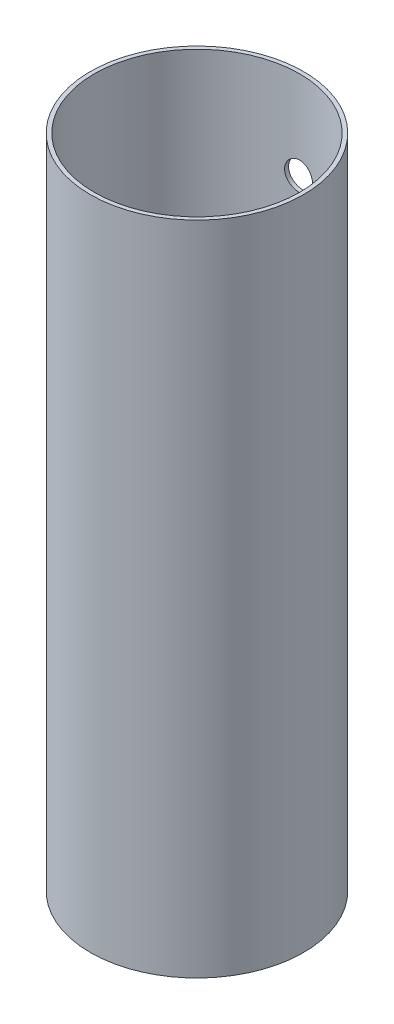
from build123d import *

# Parameters (mm, degrees)
SKETCH1_R                        = 49.5173
SKETCH1_R_2                      = 47.6885
BOSS_EXTRUDE1_DEPTH              = 304.8
SKETCH29_W                       = 6.54812
SKETCH29_H                       = 49.5173
F_1_2_CLEARANCE_HOLE8_AT_2_COUNT = 2
F_1_2_CLEARANCE_HOLE8_AT_2_PITCH = 222.123


with BuildPart() as part:
    # Sketch1 → Boss-Extrude1 (new body)
    with BuildSketch(Plane(origin=(0, 0, 0), x_dir=(1, 0, 0), z_dir=(0, 1, 0))):
        Circle(SKETCH1_R)
        Circle(SKETCH1_R_2, mode=Mode.SUBTRACT)
    extrude(amount=BOSS_EXTRUDE1_DEPTH)

    # Sketch29 → 1/2 Clearance Hole8 (revolve, cut)
    with BuildSketch(Plane(origin=(0, 263.525, 0), x_dir=(0, -1, 0), z_dir=(1, 0, 0))):
        with Locations((3.27406, 24.75865)):
            Rectangle(SKETCH29_W, SKETCH29_H)
    f_1_2_clearance_hole8 = revolve(axis=Axis((0, 263.525, 6.35), (0, 0, -1)), mode=Mode.SUBTRACT)

    # 1/2 Clearance Hole8 at 2: 1/2 Clearance Hole8 ×2
    with Locations(*[(0, -i * F_1_2_CLEARANCE_HOLE8_AT_2_PITCH, 0) for i in range(1, F_1_2_CLEARANCE_HOLE8_AT_2_COUNT)]):
        add(f_1_2_clearance_hole8, mode=Mode.SUBTRACT)


solid = part.part
